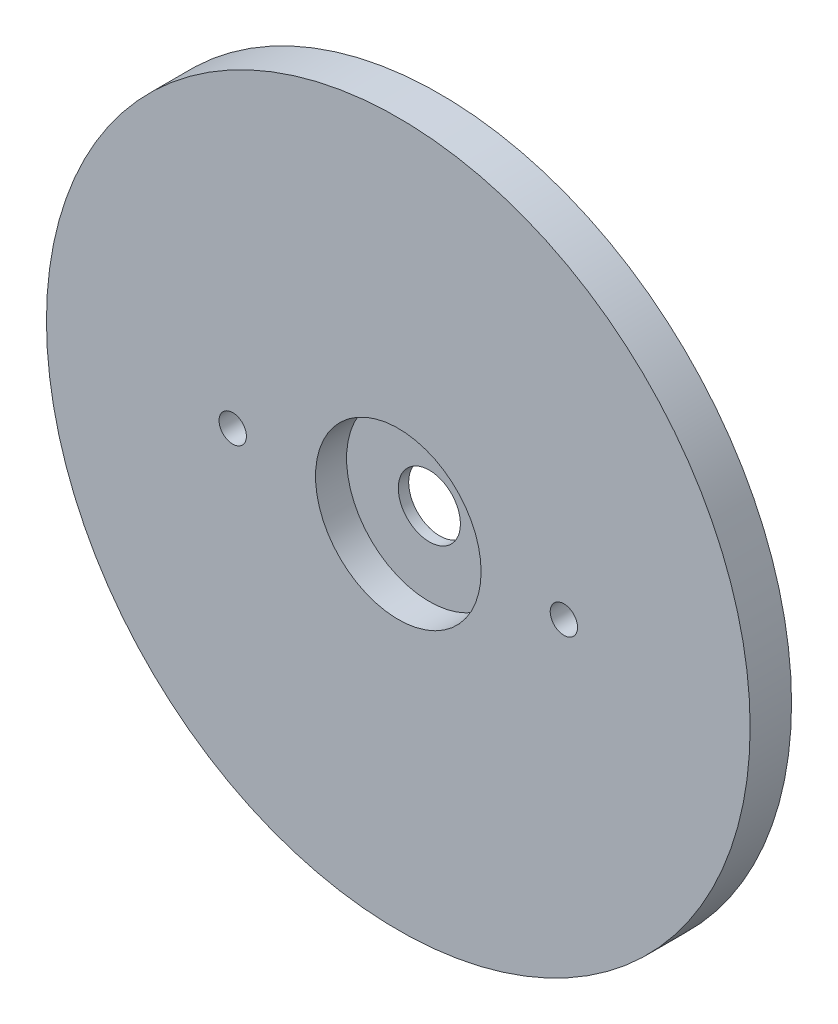
from build123d import *

# Parameters (mm, degrees)
SKETCH1_R               = 85
BOSS_EXTRUDE1_DEPTH     = 10
SKETCH2_R               = 20
CUT_EXTRUDE1_DEPTH      = 7.5
SKETCH3_R               = 7.5
CUT_EXTRUDE2_DEPTH      = 20
CUT_EXTRUDE3_DEPTH      = 121.623380818
CUT_EXTRUDE3_DEPTH_BACK = 121.623380818
SKETCH4_R               = 3.3


with BuildPart() as part:
    # Sketch1 → Boss-Extrude1 (new body)
    with BuildSketch(Plane.XY):
        Circle(SKETCH1_R)
    extrude(amount=BOSS_EXTRUDE1_DEPTH)

    # Sketch2 → Cut-Extrude1 (cut)
    with BuildSketch(Plane.XY.offset(10)):
        Circle(SKETCH2_R)
    extrude(amount=-CUT_EXTRUDE1_DEPTH, mode=Mode.SUBTRACT)

    # Sketch3 → Cut-Extrude2 (cut)
    with BuildSketch(Plane(origin=(0, 0, 0), x_dir=(-1, 0, 0), z_dir=(0, 0, -1))):
        Circle(SKETCH3_R)
    extrude(amount=-CUT_EXTRUDE2_DEPTH, mode=Mode.SUBTRACT)

    # Sketch4 → Cut-Extrude3 (cut, two sides: drawn at the far end of the back side and taken through both)
    with BuildSketch(Plane.XY.offset(10).offset(-CUT_EXTRUDE3_DEPTH_BACK)):
        with Locations((-40, 0)):
            Circle(SKETCH4_R)
        with Locations((40, 0)):
            Circle(SKETCH4_R)
    extrude(amount=CUT_EXTRUDE3_DEPTH + CUT_EXTRUDE3_DEPTH_BACK, mode=Mode.SUBTRACT)


solid = part.part
